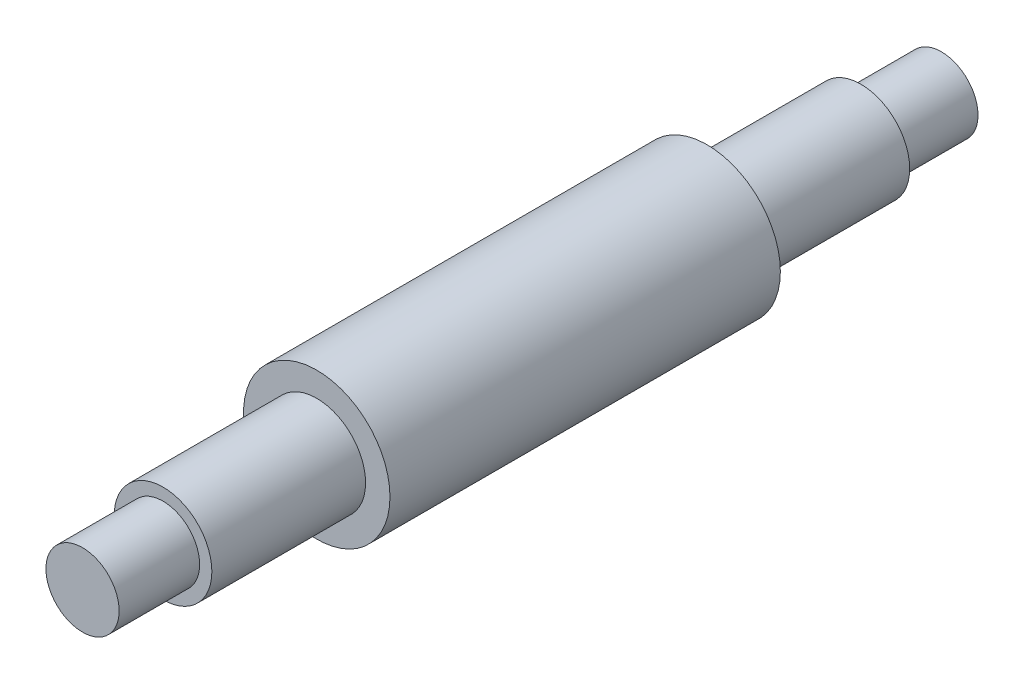
from build123d import *

# Parameters (mm, degrees)
ESQUISSE1_R        = 15
BOSS_EXTRU_1_DEPTH = 40
BOSS_EXTRU_5_START = 40
ESQUISSE1_10_R     = 10
BOSS_EXTRU_5_DEPTH = 31.5
BOSS_EXTRU_3_START = 71.5
ESQUISSE1_7_R      = 7.5
BOSS_EXTRU_3_DEPTH = 16.5
BOSS_EXTRU_4_START = -71.5
ESQUISSE1_8_R      = 7.5
BOSS_EXTRU_4_DEPTH = 16.5
BOSS_EXTRU_6_START = -71.5
ESQUISSE1_11_R     = 10
BOSS_EXTRU_6_DEPTH = 31.5


with BuildPart() as part:
    # Esquisse1 → Boss.-Extru.1 (new, symmetric)
    with BuildSketch(Plane.XY):
        Circle(ESQUISSE1_R)
    extrude(amount=BOSS_EXTRU_1_DEPTH, both=True)

    # Esquisse1<10> → Boss.-Extru.5 (add)
    with BuildSketch(Plane.XY.offset(BOSS_EXTRU_5_START)):
        Circle(ESQUISSE1_10_R)
    extrude(amount=BOSS_EXTRU_5_DEPTH)



with BuildPart() as body_2:
    # Esquisse1<7> → Boss.-Extru.3 (new body)
    with BuildSketch(Plane.XY.offset(BOSS_EXTRU_3_START)):
        Circle(ESQUISSE1_7_R)
    extrude(amount=BOSS_EXTRU_3_DEPTH)


with BuildPart() as body_3:
    # Esquisse1<8> → Boss.-Extru.4 (new body)
    with BuildSketch(Plane.XY.offset(BOSS_EXTRU_4_START)):
        Circle(ESQUISSE1_8_R)
    extrude(amount=-BOSS_EXTRU_4_DEPTH)


with BuildPart() as part_1:
    add(part.part)

    add(body_3.part)  # Boss.-Extru.6 merges body 3
    # Esquisse1<11> → Boss.-Extru.6 (add)
    with BuildSketch(Plane.XY.offset(BOSS_EXTRU_6_START)):
        Circle(ESQUISSE1_11_R)
    extrude(amount=BOSS_EXTRU_6_DEPTH)


solid = Compound([body_2.part, part_1.part])
